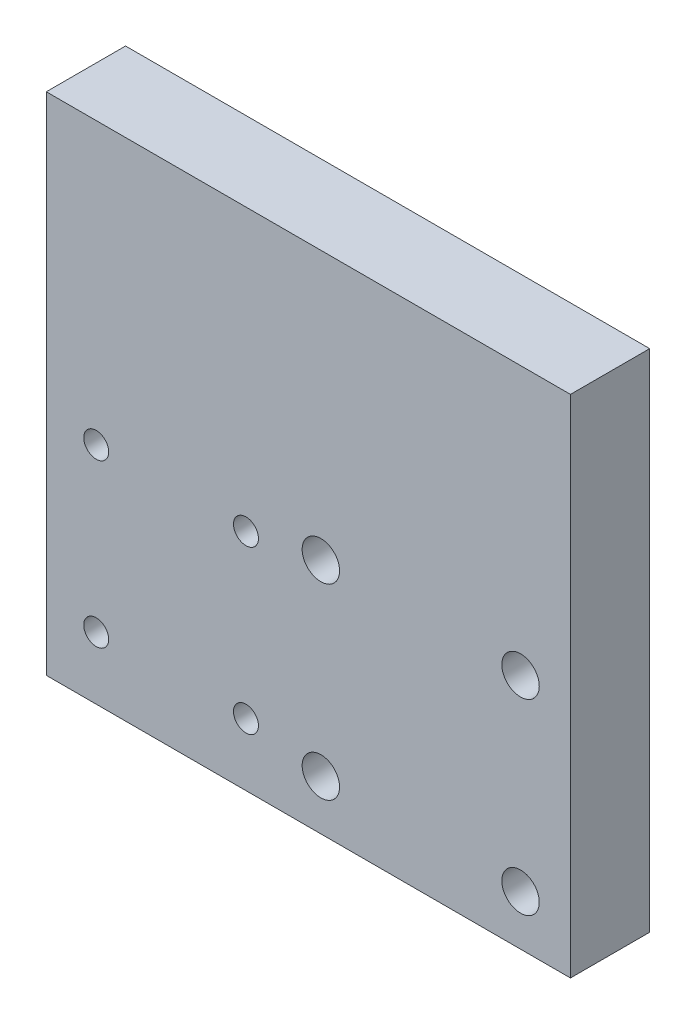
from build123d import *

# Parameters (mm, degrees)
SKETCH1_W           = 42
SKETCH1_H           = 40.5
SKETCH1_R           = 1
SKETCH1_R_2         = 1.5
BOSS_EXTRUDE1_DEPTH = 6.35


with BuildPart() as part:
    # Sketch1 → Boss-Extrude1 (new body)
    with BuildSketch(Plane.XY):
        with Locations((-9, 8.75)):
            Rectangle(SKETCH1_W, SKETCH1_H)
        with Locations((-26, -6.5)):
            Circle(SKETCH1_R, mode=Mode.SUBTRACT)
        with Locations((-14, -6.5)):
            Circle(SKETCH1_R, mode=Mode.SUBTRACT)
        with Locations((-26, 6.5)):
            Circle(SKETCH1_R, mode=Mode.SUBTRACT)
        with Locations((-14, 6.5)):
            Circle(SKETCH1_R, mode=Mode.SUBTRACT)
        with Locations((-8, -7.5)):
            Circle(SKETCH1_R_2, mode=Mode.SUBTRACT)
        with Locations((8, -7.5)):
            Circle(SKETCH1_R_2, mode=Mode.SUBTRACT)
        with Locations((-8, 7.5)):
            Circle(SKETCH1_R_2, mode=Mode.SUBTRACT)
        with Locations((8, 7.5)):
            Circle(SKETCH1_R_2, mode=Mode.SUBTRACT)
    extrude(amount=BOSS_EXTRUDE1_DEPTH)


solid = part.part
